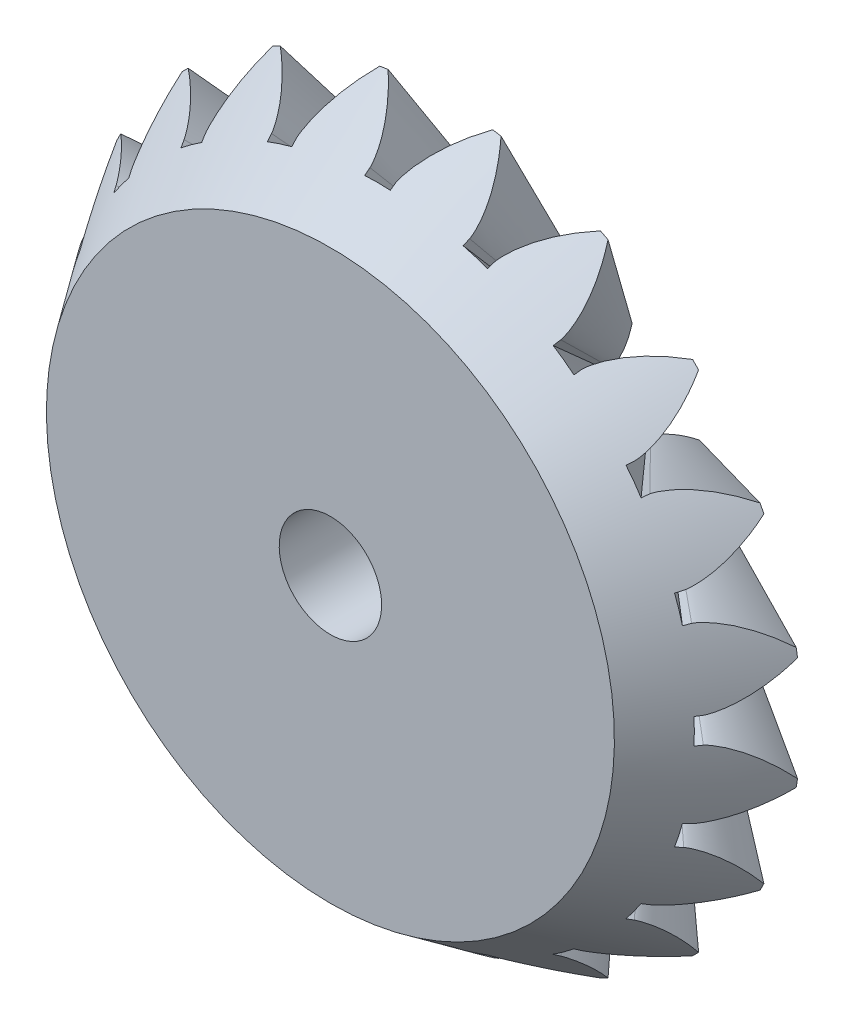
from build123d import *

# Parameters (mm, degrees)
PATTERN_CIRCULAR_1_COUNT = 20
SKETCH_6_R               = 1.5
CUT_EXTRUDE_1_DEPTH      = 16.815447699


# Read off the part's stored shape, not the designer's step: 旋转1
with BuildPart() as part:
    # 旋转1 outline → 旋转1 (revolve)
    with BuildSketch(Plane.XZ):
        Polygon((0, -11.88420688), (0, -17.471628852), (3.925253236, -17.471628852), (4.680079153, -18.549951591), (10.573462344, -15.104946206), (8.318944816, -11.88420688), align=None)
    revolve(axis=Axis((0, 0, 0), (0, 0, 1)))

    # 草图3 → 切除-放样2 section 0
    with BuildSketch(Plane(origin=(0, 4.265376556, -6.093395081), x_dir=(1, 0, 0), z_dir=(0, 0.8192319205190406, 0.5734623443633282)), mode=Mode.PRIVATE) as loft_2_s0:
        with BuildLine():
            Line((0.379438673, 8.940315431), (0.379438673, 8.74176906))
            ThreePointArc((0.379438673, 8.74176906), (0.004209495, 8.749998987), (-0.371027428, 8.742130098))
            Line((-0.371027428, 8.742130098), (-0.379438673, 8.940315431))
            add(Edge.make_bspline(
                [(-0.379438673, 8.940315431), (-0.379906929, 8.947556855), (-0.381716552, 8.967828416), (-0.387095345, 9.005974365), (-0.398634908, 9.067811444), (-0.417375271, 9.145889718), (-0.446189476, 9.245774087), (-0.485981938, 9.361915909), (-0.535765216, 9.487703788), (-0.596361292, 9.622308375), (-0.662428862, 9.75441589), (-0.733473421, 9.883994623), (-0.808829667, 10.010972677), (-0.90541984, 10.162118156), (-1.028567078, 10.339529204), (-1.182863159, 10.540853561), (-1.369855155, 10.7616912), (-1.572737722, 10.97812193), (-1.782337881, 11.183780022), (-2.005002956, 11.382604027), (-2.199119172, 11.544385802), (-2.347222375, 11.658317394), (-2.434716889, 11.723603723), (-2.463029097, 11.74450883)],
                knots=[0, 0, 0, 0, 0, 0.005376748, 0.015083688, 0.02853182, 0.046610139, 0.064854849, 0.092110525, 0.119476175, 0.146842495, 0.174208853, 0.201574955, 0.228941013, 0.256307345, 0.307035032, 0.361767351, 0.41649966, 0.471231936, 0.525964281, 0.580696615, 0.635428982, 0.661689565, 0.661689565, 0.661689565, 0.661689565, 0.661689565], degree=4))
            ThreePointArc((-2.463029097, 11.74450883), (0, 12), (2.463029097, 11.74450883))
            add(Edge.make_bspline(
                [(0.379438673, 8.940315431), (0.379906929, 8.947556855), (0.381716552, 8.967828416), (0.387095345, 9.005974365), (0.398634908, 9.067811444), (0.417375271, 9.145889718), (0.446189476, 9.245774087), (0.485981938, 9.361915909), (0.535765216, 9.487703788), (0.596361292, 9.622308375), (0.662428862, 9.75441589), (0.733473421, 9.883994623), (0.808829667, 10.010972677), (0.90541984, 10.162118156), (1.028567078, 10.339529204), (1.182863159, 10.540853561), (1.369855155, 10.7616912), (1.572737722, 10.97812193), (1.782337881, 11.183780022), (2.005002956, 11.382604027), (2.199119172, 11.544385802), (2.347222375, 11.658317394), (2.434716889, 11.723603723), (2.463029097, 11.74450883)],
                knots=[0, 0, 0, 0, 0, 0.005376748, 0.015083688, 0.02853182, 0.046610139, 0.064854849, 0.092110525, 0.119476175, 0.146842495, 0.174208853, 0.201574955, 0.228941013, 0.256307345, 0.307035032, 0.361767351, 0.41649966, 0.471231936, 0.525964281, 0.580696615, 0.635428982, 0.661689565, 0.661689565, 0.661689565, 0.661689565, 0.661689565], degree=4))
        make_face()
    loft_2 = loft([loft_2_s0.sketch, Vertex(0, 0, -21.285714286)], mode=Mode.SUBTRACT)

    # 阵列(圆周)1: 切除-放样2 ×20 about axis
    pattern_circular_1_axis = Axis((0, 0, -18.549951591), (0, 0, 1))
    for i in range(1, PATTERN_CIRCULAR_1_COUNT):
        add(loft_2.rotate(pattern_circular_1_axis, i * 360 / PATTERN_CIRCULAR_1_COUNT), mode=Mode.SUBTRACT)

    # 草图6 → 切除-拉伸1 (cut, through all)
    with BuildSketch(Plane(origin=(0, 0, -17.471628852), x_dir=(-1, 0, 0), z_dir=(0, 0, -1))):
        with Locations(Location((0, 0, 0), (0, 0, 90))):
            Circle(SKETCH_6_R)
    extrude(amount=-CUT_EXTRUDE_1_DEPTH, mode=Mode.SUBTRACT)


solid = part.part
